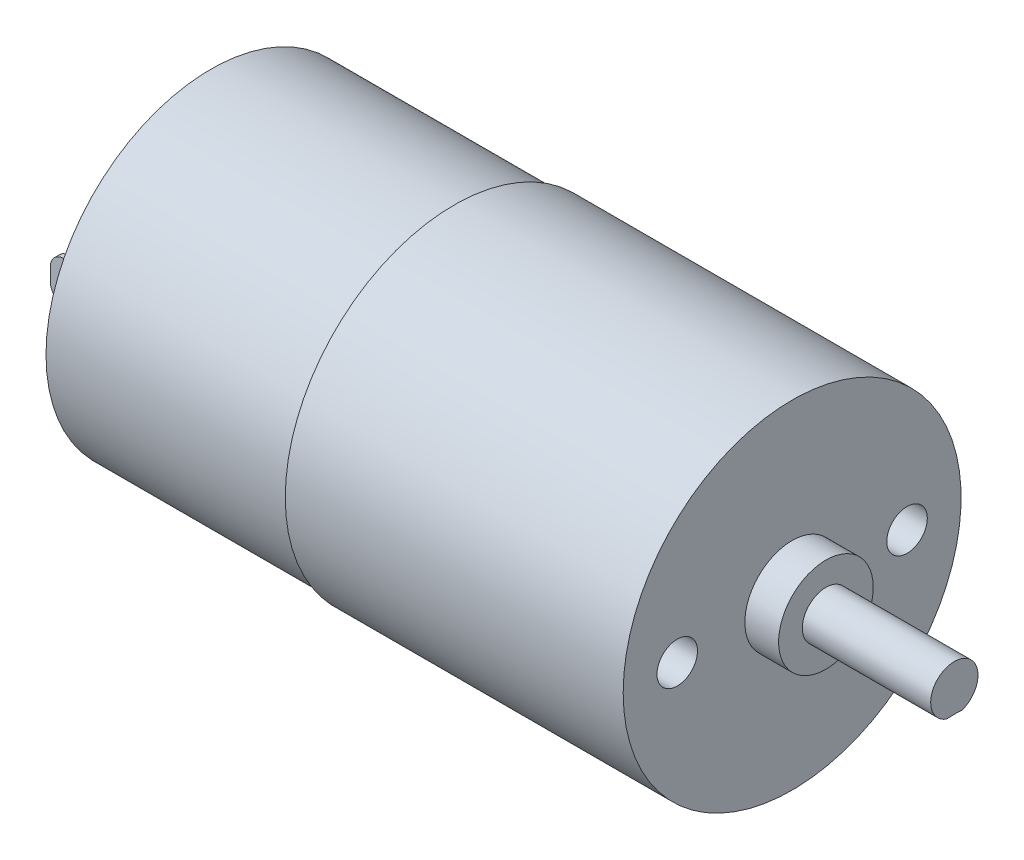
from build123d import *

# Parameters (mm, degrees)
CROQUIS1_W                        = 25
CROQUIS1_H                        = 12.5
CROQUIS2_R                        = 3.5
SALIENTE_EXTRUIR1_DEPTH           = 2.5
CROQUIS3_R                        = 1.75
SALIENTE_EXTRUIR2_DEPTH           = 9.5
CORTAR_EXTRUIR1_DEPTH             = 8
CROQUIS5_R                        = 12.2
SALIENTE_EXTRUIR3_DEPTH           = 18
DI_METRO_DE_TALADRO_3_0_3_1_D     = 3
DI_METRO_DE_TALADRO_3_0_3_1_DEPTH = 8
CROQUIS10_R                       = 11.5
CORTAR_EXTRUIR2_DEPTH             = 2
SALIENTE_EXTRUIR4_DEPTH           = 1
CROQUIS12_W                       = 0.4
CROQUIS12_H                       = 3
SALIENTE_EXTRUIR5_DEPTH           = 6
REDONDEO1_R                       = 1
CORTAR_EXTRUIR3_DEPTH             = 57.252161552
CROQUIS15_R                       = 2.5
SALIENTE_EXTRUIR6_DEPTH           = 2
CROQUIS16_R                       = 1.5
SALIENTE_EXTRUIR7_DEPTH           = 3
CHAFL_N1_SIZE2                    = 0.363970234
CHAFL_N1_SIZE                     = 1
CROQUIS17_R                       = 1
CORTAR_EXTRUIR4_DEPTH             = 1


with BuildPart() as part:
    # Croquis1 → Revolución1 (revolve)
    with BuildSketch(Plane(origin=(0, 0, 0), x_dir=(-1, 0, 0), z_dir=(0, 0, -1)), mode=Mode.PRIVATE) as revoluci_n1_sk:
        with Locations((14, 12.15)):
            Rectangle(CROQUIS1_W, CROQUIS1_H)
    revolve(revoluci_n1_sk.sketch.rotate(Axis((-1.5, 5.9, 0), (-1, 0, 0)), 270), axis=Axis((-1.5, 5.9, 0), (-1, 0, 0)))

    # Croquis2 → Saliente-Extruir1 (add)
    with BuildSketch(Plane(origin=(-1.5, 0, 0), x_dir=(0, 0, -1), z_dir=(1, 0, 0))):
        with Locations((0, 5.9)):
            Circle(CROQUIS2_R)
    extrude(amount=SALIENTE_EXTRUIR1_DEPTH)

    # Croquis3 → Saliente-Extruir2 (add)
    with BuildSketch(Plane(origin=(1, 0, 0), x_dir=(0, 0, -1), z_dir=(1, 0, 0))):
        with Locations((0, 5.9)):
            Circle(CROQUIS3_R)
    extrude(amount=SALIENTE_EXTRUIR2_DEPTH)

    # Croquis4 → Cortar-Extruir1 (cut)
    with BuildSketch(Plane(origin=(10.5, 0, 0), x_dir=(0, 0, -1), z_dir=(1, 0, 0))):
        with BuildLine():
            Line((-1.496663044, 4.15), (1.496663044, 4.15))
            ThreePointArc((1.496663044, 4.15), (0, 4.264202971), (-1.496663044, 4.15))
        make_face()
    extrude(amount=-CORTAR_EXTRUIR1_DEPTH, mode=Mode.SUBTRACT)

    # Croquis5 → Saliente-Extruir3 (add)
    with BuildSketch(Plane.ZY.offset(26.5)):
        with Locations((0, 5.9)):
            Circle(CROQUIS5_R)
    extrude(amount=SALIENTE_EXTRUIR3_DEPTH)

    # Diámetro de taladro Ø3.0 (3)1
    with Locations(Plane(origin=(-1.5, 0, 0), x_dir=(0, 0, -1), z_dir=(1, 0, 0))):
        with Locations((-8.5, 5.827133015), (8.5, 5.827133015)):
            Hole(DI_METRO_DE_TALADRO_3_0_3_1_D / 2, depth=DI_METRO_DE_TALADRO_3_0_3_1_DEPTH)

    # Croquis10 → Cortar-Extruir2 (cut)
    with BuildSketch(Plane.ZY.offset(44.5)):
        with Locations((0, 5.9)):
            Circle(CROQUIS10_R)
    extrude(amount=-CORTAR_EXTRUIR2_DEPTH, mode=Mode.SUBTRACT)

    # Croquis11 → Saliente-Extruir4 (add)
    with BuildSketch(Plane.ZY.offset(42.5)):
        with BuildLine():
            Line((-5.135046812, 3.4), (-6.135046812, 3.4))
            ThreePointArc((-6.135046812, 3.4), (-6.488600202, 3.546446609), (-6.635046812, 3.9))
            Line((-6.635046812, 3.9), (-6.635046812, 7.9))
            ThreePointArc((-6.635046812, 7.9), (-6.488600202, 8.253553391), (-6.135046812, 8.4))
            Line((-6.135046812, 8.4), (-5.135046812, 8.4))
            ThreePointArc((-5.135046812, 8.4), (-4.781493421, 8.253553391), (-4.635046812, 7.9))
            Line((-4.635046812, 7.9), (-4.635046812, 3.9))
            ThreePointArc((-4.635046812, 3.9), (-4.781493421, 3.546446609), (-5.135046812, 3.4))
        make_face()
        with BuildLine():
            Line((7.124953188, 3.4), (6.124953188, 3.4))
            ThreePointArc((6.124953188, 3.4), (5.771399798, 3.546446609), (5.624953188, 3.9))
            Line((5.624953188, 3.9), (5.624953188, 7.9))
            ThreePointArc((5.624953188, 7.9), (5.771399798, 8.253553391), (6.124953188, 8.4))
            Line((6.124953188, 8.4), (7.124953188, 8.4))
            ThreePointArc((7.124953188, 8.4), (7.478506579, 8.253553391), (7.624953188, 7.9))
            Line((7.624953188, 7.9), (7.624953188, 3.9))
            ThreePointArc((7.624953188, 3.9), (7.478506579, 3.546446609), (7.124953188, 3.4))
        make_face()
    extrude(amount=SALIENTE_EXTRUIR4_DEPTH)

    # Croquis12 → Saliente-Extruir5 (add)
    with BuildSketch(Plane.ZY.offset(43.5)):
        with Locations((-5.637636684, 5.837666005)):
            Rectangle(CROQUIS12_W, CROQUIS12_H)
        with Locations((6.677710889, 5.9)):
            Rectangle(CROQUIS12_W, CROQUIS12_H)
    extrude(amount=SALIENTE_EXTRUIR5_DEPTH)

    # Redondeo1
    redondeo1_edges = [part.edges().sort_by_distance(p)[0] for p in [
        (-49.5, 4.337666005, -5.637636684),
        (-49.5, 7.337666005, -5.637636684),
        (-49.5, 4.4, 6.677710889),
        (-49.5, 7.4, 6.677710889),
    ]]
    fillet(redondeo1_edges, radius=REDONDEO1_R)

    # Croquis14 → Cortar-Extruir3 (cut, through all)
    with BuildSketch(Plane.XY.offset(6.877710889)):
        with BuildLine():
            Line((-45.3, 5.2), (-47.7, 5.2))
            ThreePointArc((-47.7, 5.2), (-47.912132034, 5.287867966), (-48, 5.5))
            Line((-48, 5.5), (-48, 6.3))
            ThreePointArc((-48, 6.3), (-47.912132034, 6.512132034), (-47.7, 6.6))
            Line((-47.7, 6.6), (-45.3, 6.6))
            ThreePointArc((-45.3, 6.6), (-45.087867966, 6.512132034), (-45, 6.3))
            Line((-45, 6.3), (-45, 5.5))
            ThreePointArc((-45, 5.5), (-45.087867966, 5.287867966), (-45.3, 5.2))
        make_face()
    extrude(amount=-CORTAR_EXTRUIR3_DEPTH, mode=Mode.SUBTRACT)

    # Croquis15 → Saliente-Extruir6 (add)
    with BuildSketch(Plane.ZY.offset(42.5)):
        with Locations((0, 5.9)):
            Circle(CROQUIS15_R)
    extrude(amount=SALIENTE_EXTRUIR6_DEPTH)

    # Croquis16 → Saliente-Extruir7 (add)
    with BuildSketch(Plane.ZY.offset(42.5)):
        with Locations((0, 5.9)):
            Circle(CROQUIS16_R)
    extrude(amount=SALIENTE_EXTRUIR7_DEPTH)

    # Chaflán1
    chafl_n1_edges = [part.edges().sort_by_distance(p)[0] for p in [
        (-45.5, 5.9, -1.5),
    ]]
    chafl_n1_side = [part.faces().sort_by_distance(p)[0] for p in [
        (-45.492720595, 5.9, -1.5),
    ]]
    chamfer(chafl_n1_edges, length=CHAFL_N1_SIZE - 0.0001, length2=CHAFL_N1_SIZE2 - 0.0001, reference=chafl_n1_side[0])  # a hair under: the kernel refuses the full size

    # Croquis17 → Cortar-Extruir4 (cut)
    with BuildSketch(Plane.ZY.offset(45.5)):
        with Locations((0, 5.9)):
            Circle(CROQUIS17_R)
    extrude(amount=-CORTAR_EXTRUIR4_DEPTH, mode=Mode.SUBTRACT)


solid = part.part
